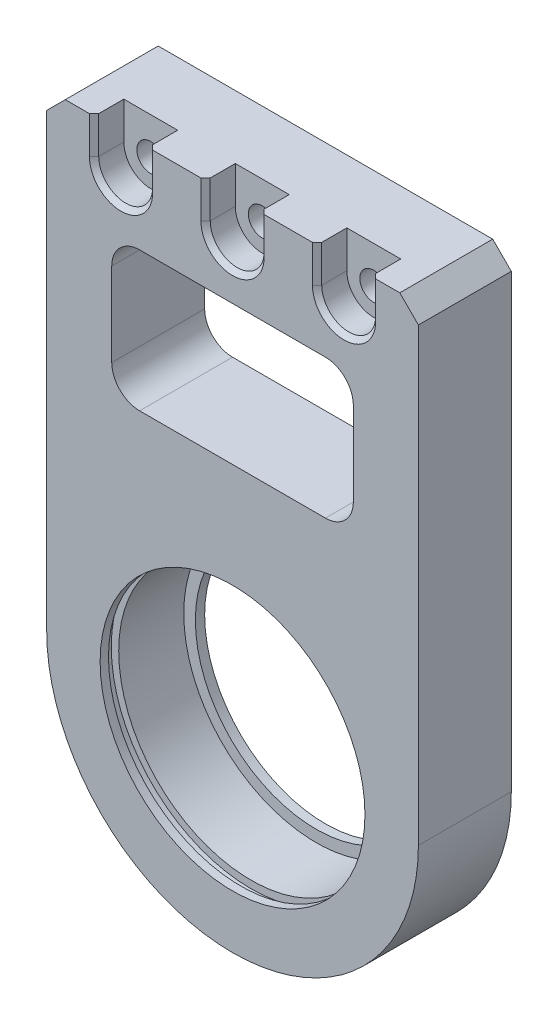
from build123d import *

# Parameters (mm, degrees)
SKETCH_1_W          = 40
SKETCH_1_H          = 70.5
EXTRUDE_1_DEPTH     = 10
SKETCH_2_R          = 14.25
CUT_EXTRUDE_1_DEPTH = 12
SKETCH_3_R          = 15.05
CUT_EXTRUDE_2_DEPTH = 1.1
CHAMFER_1_SIZE      = 2
FILLET_1_R          = 20
SKETCH_4_R          = 1.5
CUT_EXTRUDE_3_DEPTH = 15
SKETCH_5_W          = 26
SKETCH_5_H          = 15
CUT_EXTRUDE_4_DEPTH = 15
FILLET_2_R          = 3
EXTRUDE_START       = -1
SKETCH_7_R          = 14.25
SKETCH_7_R_2        = 13
EXTRUDE_2_DEPTH     = 1
CUT_EXTRUDE_5_DEPTH = 3.2
CHAMFER_2_SIZE      = 0.5


with BuildPart() as part:
    # 草图1 → 凸台-拉伸1 (new body)
    with BuildSketch(Plane.XY):
        with Locations((20, -34.75)):
            Rectangle(SKETCH_1_W, SKETCH_1_H)
    extrude(amount=EXTRUDE_1_DEPTH)

    # 草图2 → 切除-拉伸1 (cut)
    with BuildSketch(Plane.XY.offset(10)):
        with Locations((20, -50)):
            Circle(SKETCH_2_R)
    extrude(amount=-CUT_EXTRUDE_1_DEPTH, mode=Mode.SUBTRACT)

    # 草图3 → 切除-拉伸2 (cut)
    with BuildSketch(Plane(origin=(0, 0, 8), x_dir=(-1, 0, 0), z_dir=(0, 0, -1))):
        with Locations((-20, -50)):
            Circle(SKETCH_3_R)
    extrude(amount=-CUT_EXTRUDE_2_DEPTH, mode=Mode.SUBTRACT)

    # 倒角1
    chamfer_1_edges = [part.edges().sort_by_distance(p)[0] for p in [
        (0, 0.5, 5),
        (40, 0.5, 5),
    ]]
    chamfer(chamfer_1_edges, length=CHAMFER_1_SIZE)

    # 圆角1
    fillet_1_edges = [part.edges().sort_by_distance(p)[0] for p in [
        (0, -70, 5),
        (40, -70, 5),
    ]]
    fillet(fillet_1_edges, radius=FILLET_1_R - 0.0001)  # a hair under: the kernel refuses the full size

    # 草图4 → 切除-拉伸3 (cut)
    with BuildSketch(Plane(origin=(0, 0, 0), x_dir=(-1, 0, 0), z_dir=(0, 0, -1))):
        with Locations((-32, -3.5)):
            Circle(SKETCH_4_R)
        with Locations((-20, -3.5)):
            Circle(SKETCH_4_R)
        with Locations((-8, -3.5)):
            Circle(SKETCH_4_R)
    extrude(amount=-CUT_EXTRUDE_3_DEPTH, mode=Mode.SUBTRACT)

    # 草图5 → 切除-拉伸4 (cut)
    with BuildSketch(Plane(origin=(0, 0, 0), x_dir=(-1, 0, 0), z_dir=(0, 0, -1))):
        with Locations((-20, -17)):
            Rectangle(SKETCH_5_W, SKETCH_5_H)
    extrude(amount=-CUT_EXTRUDE_4_DEPTH, mode=Mode.SUBTRACT)

    # 圆角2
    fillet_2_edges = [part.edges().sort_by_distance(p)[0] for p in [
        (7, -9.5, 5),
        (7, -24.5, 5),
        (33, -24.5, 5),
        (33, -9.5, 5),
    ]]
    fillet(fillet_2_edges, radius=FILLET_2_R)

    # 草图7 → 凸台-拉伸2 (add)
    with BuildSketch(Plane(origin=(0, 0, 0), x_dir=(-1, 0, 0), z_dir=(0, 0, -1)).offset(EXTRUDE_START)):
        with Locations((-20, -50)):
            Circle(SKETCH_7_R)
        with Locations((-20, -50)):
            Circle(SKETCH_7_R_2, mode=Mode.SUBTRACT)
    extrude(amount=EXTRUDE_2_DEPTH)

    # 草图8 → 切除-拉伸5 (cut)
    with BuildSketch(Plane.XY.offset(10)):
        with BuildLine():
            Line((5.1, -3.5), (5.1, 0.5))
            Line((5.1, 0.5), (10.9, 0.5))
            Line((10.9, 0.5), (10.9, -3.5))
            ThreePointArc((10.9, -3.5), (8, -6.4), (5.1, -3.5))
        make_face()
        with BuildLine():
            Line((17.1, -3.5), (17.1, 0.5))
            Line((17.1, 0.5), (22.9, 0.5))
            Line((22.9, 0.5), (22.9, -3.5))
            ThreePointArc((22.9, -3.5), (20, -6.4), (17.1, -3.5))
        make_face()
        with BuildLine():
            Line((34.9, -3.5), (34.9, 0.5))
            Line((34.9, 0.5), (29.1, 0.5))
            Line((29.1, 0.5), (29.1, -3.5))
            ThreePointArc((29.1, -3.5), (32, -6.4), (34.9, -3.5))
        make_face()
    extrude(amount=-CUT_EXTRUDE_5_DEPTH, mode=Mode.SUBTRACT)

    # 倒角2
    chamfer_2_edges = [part.edges().sort_by_distance(p)[0] for p in [
        (8, -6.4, 10),
        (10.9, -1.5, 10),
        (5.1, -1.5, 10),
        (32, -6.4, 10),
        (34.9, -1.5, 10),
        (29.1, -1.5, 10),
        (20, -6.4, 10),
        (22.9, -1.5, 10),
        (17.1, -1.5, 10),
    ]]
    chamfer(chamfer_2_edges, length=CHAMFER_2_SIZE)


solid = part.part
